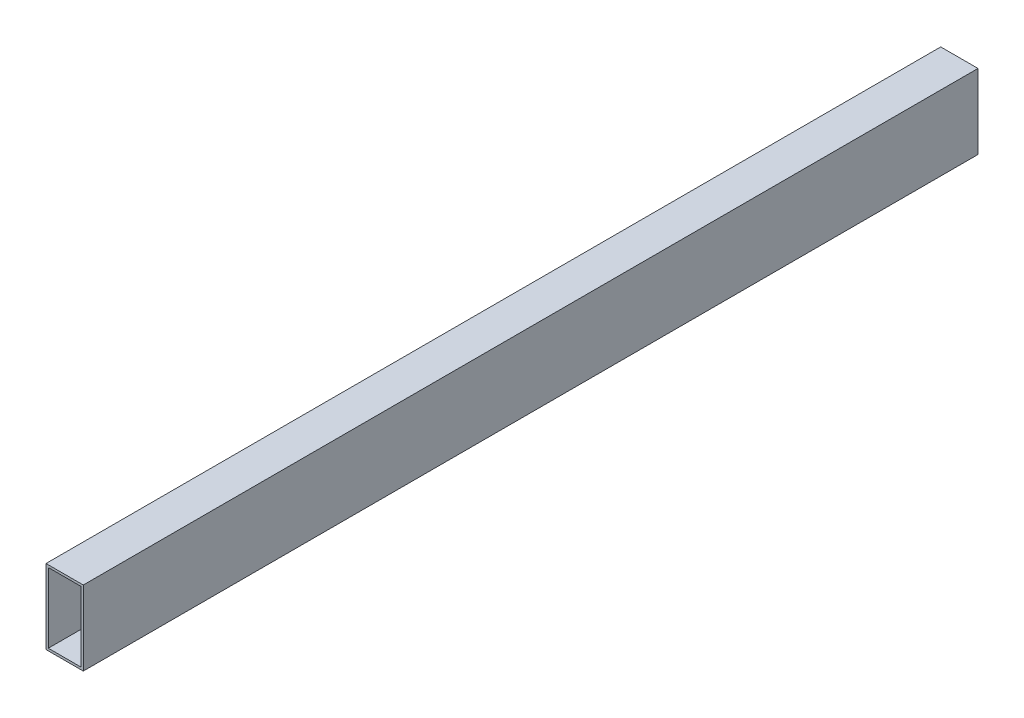
from build123d import *

# Parameters (mm, degrees)
SKETCH1_W           = 25.4
SKETCH1_H           = 50.8
SKETCH1_W_2         = 22.225
SKETCH1_H_2         = 47.625
BOSS_EXTRUDE1_DEPTH = 609.6
CUT_EXTRUDE1_REACH  = 614.24
SKETCH2_R           = 2.4892


with BuildPart() as part:
    # Sketch1 → Boss-Extrude1 (new body)
    with BuildSketch(Plane.XY):
        with Locations((12.7, 25.4)):
            Rectangle(SKETCH1_W, SKETCH1_H)
        with Locations((12.7, 25.4)):
            Rectangle(SKETCH1_W_2, SKETCH1_H_2, mode=Mode.SUBTRACT)
    extrude(amount=BOSS_EXTRUDE1_DEPTH)

    # Sketch2 → Cut-Extrude1 (cut, up to next)
    with BuildSketch(Plane.ZY, mode=Mode.PRIVATE) as cut_extrude1_sk1:
        with Locations((558.8, 38.1)):
            Circle(SKETCH2_R)
    cut_extrude1_tool1 = extrude(cut_extrude1_sk1.sketch, amount=-CUT_EXTRUDE1_REACH, mode=Mode.PRIVATE) & part.part
    # Sketch2 → Cut-Extrude1 (cut, up to next)
    with BuildSketch(Plane.ZY, mode=Mode.PRIVATE) as cut_extrude1_sk2:
        with Locations((533.4, 38.1)):
            Circle(SKETCH2_R)
    cut_extrude1_tool2 = extrude(cut_extrude1_sk2.sketch, amount=-CUT_EXTRUDE1_REACH, mode=Mode.PRIVATE) & part.part
    # Sketch2 → Cut-Extrude1 (cut, up to next)
    with BuildSketch(Plane.ZY, mode=Mode.PRIVATE) as cut_extrude1_sk3:
        with Locations((508, 38.1)):
            Circle(SKETCH2_R)
    cut_extrude1_tool3 = extrude(cut_extrude1_sk3.sketch, amount=-CUT_EXTRUDE1_REACH, mode=Mode.PRIVATE) & part.part
    # Sketch2 → Cut-Extrude1 (cut, up to next)
    with BuildSketch(Plane.ZY, mode=Mode.PRIVATE) as cut_extrude1_sk4:
        with Locations((482.6, 38.1)):
            Circle(SKETCH2_R)
    cut_extrude1_tool4 = extrude(cut_extrude1_sk4.sketch, amount=-CUT_EXTRUDE1_REACH, mode=Mode.PRIVATE) & part.part
    # Sketch2 → Cut-Extrude1 (cut, up to next)
    with BuildSketch(Plane.ZY, mode=Mode.PRIVATE) as cut_extrude1_sk5:
        with Locations((558.8, 12.7)):
            Circle(SKETCH2_R)
    cut_extrude1_tool5 = extrude(cut_extrude1_sk5.sketch, amount=-CUT_EXTRUDE1_REACH, mode=Mode.PRIVATE) & part.part
    # Sketch2 → Cut-Extrude1 (cut, up to next)
    with BuildSketch(Plane.ZY, mode=Mode.PRIVATE) as cut_extrude1_sk6:
        with Locations((533.4, 12.7)):
            Circle(SKETCH2_R)
    cut_extrude1_tool6 = extrude(cut_extrude1_sk6.sketch, amount=-CUT_EXTRUDE1_REACH, mode=Mode.PRIVATE) & part.part
    # Sketch2 → Cut-Extrude1 (cut, up to next)
    with BuildSketch(Plane.ZY, mode=Mode.PRIVATE) as cut_extrude1_sk7:
        with Locations((508, 12.7)):
            Circle(SKETCH2_R)
    cut_extrude1_tool7 = extrude(cut_extrude1_sk7.sketch, amount=-CUT_EXTRUDE1_REACH, mode=Mode.PRIVATE) & part.part
    # Sketch2 → Cut-Extrude1 (cut, up to next)
    with BuildSketch(Plane.ZY, mode=Mode.PRIVATE) as cut_extrude1_sk8:
        with Locations((482.6, 12.7)):
            Circle(SKETCH2_R)
    cut_extrude1_tool8 = extrude(cut_extrude1_sk8.sketch, amount=-CUT_EXTRUDE1_REACH, mode=Mode.PRIVATE) & part.part
    # Sketch2 → Cut-Extrude1 (cut, up to next)
    with BuildSketch(Plane.ZY, mode=Mode.PRIVATE) as cut_extrude1_sk9:
        with Locations((584.2, 12.7)):
            Circle(SKETCH2_R)
    cut_extrude1_tool9 = extrude(cut_extrude1_sk9.sketch, amount=-CUT_EXTRUDE1_REACH, mode=Mode.PRIVATE) & part.part
    # Sketch2 → Cut-Extrude1 (cut, up to next)
    with BuildSketch(Plane.ZY, mode=Mode.PRIVATE) as cut_extrude1_sk10:
        with Locations((584.2, 38.1)):
            Circle(SKETCH2_R)
    cut_extrude1_tool10 = extrude(cut_extrude1_sk10.sketch, amount=-CUT_EXTRUDE1_REACH, mode=Mode.PRIVATE) & part.part
    add(cut_extrude1_tool1.solids().sort_by_distance((0, 38.1, 558.8))[0], mode=Mode.SUBTRACT)
    add(cut_extrude1_tool2.solids().sort_by_distance((0, 38.1, 533.4))[0], mode=Mode.SUBTRACT)
    add(cut_extrude1_tool3.solids().sort_by_distance((0, 38.1, 508))[0], mode=Mode.SUBTRACT)
    add(cut_extrude1_tool4.solids().sort_by_distance((0, 38.1, 482.6))[0], mode=Mode.SUBTRACT)
    add(cut_extrude1_tool5.solids().sort_by_distance((0, 12.7, 558.8))[0], mode=Mode.SUBTRACT)
    add(cut_extrude1_tool6.solids().sort_by_distance((0, 12.7, 533.4))[0], mode=Mode.SUBTRACT)
    add(cut_extrude1_tool7.solids().sort_by_distance((0, 12.7, 508))[0], mode=Mode.SUBTRACT)
    add(cut_extrude1_tool8.solids().sort_by_distance((0, 12.7, 482.6))[0], mode=Mode.SUBTRACT)
    add(cut_extrude1_tool9.solids().sort_by_distance((0, 12.7, 584.2))[0], mode=Mode.SUBTRACT)
    add(cut_extrude1_tool10.solids().sort_by_distance((0, 38.1, 584.2))[0], mode=Mode.SUBTRACT)


solid = part.part
